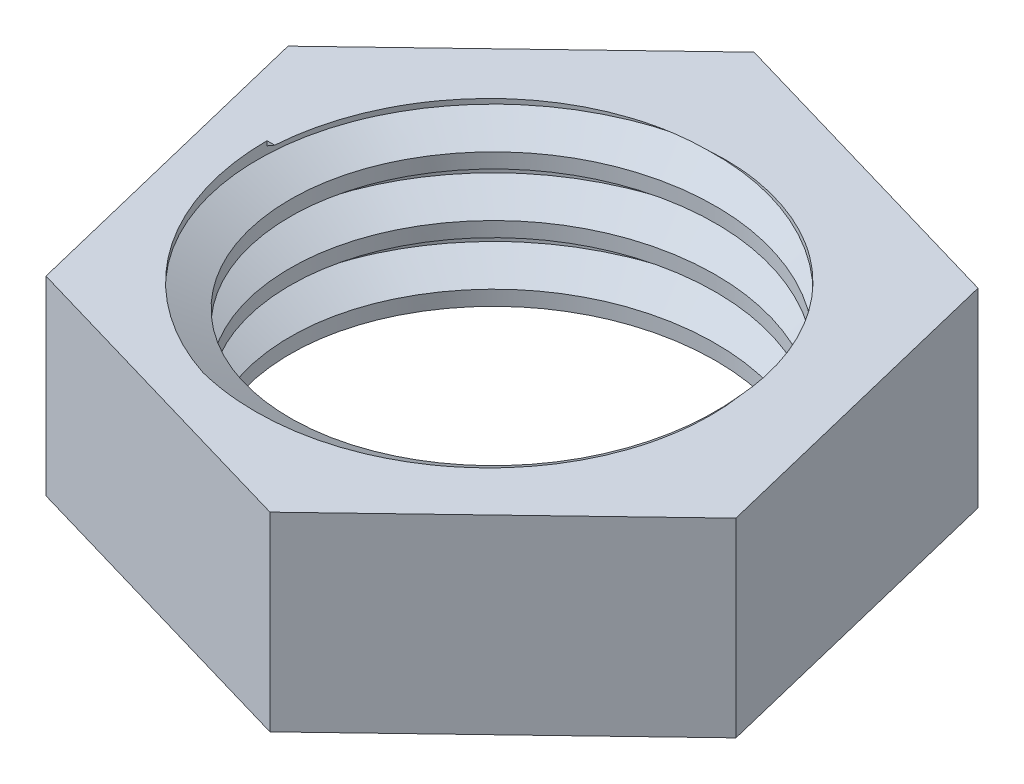
from build123d import *

# Parameters (mm, degrees)
BOSS_EXTRUDE1_DEPTH = 4
SKETCH2_R           = 5.15
CUT_EXTRUDE1_DEPTH  = 11.272655189
THREAD2_PITCH       = 1.25
SKETCH7_R           = 21.028311622
CUT_EXTRUDE2_DEPTH  = 11.701830703
SKETCH8_R           = 21.037382845
CUT_EXTRUDE3_DEPTH  = 11.272655358


with BuildPart() as part:
    # Sketch1 → Boss-Extrude1 (new body)
    with BuildSketch(Plane(origin=(0, 0, 0), x_dir=(1, 0, 0), z_dir=(0, 1, 0))):
        Polygon((5.00756352, 4.787933541), (-1.642690318, 6.73064399), (-6.650253838, 1.942710449), (-5.00756352, -4.787933541), (1.642690318, -6.73064399), (6.650253838, -1.942710449), align=None)
    extrude(amount=BOSS_EXTRUDE1_DEPTH)

    # Sketch2 → Cut-Extrude1 (cut, through all)
    with BuildSketch(Plane(origin=(0, 4, 0), x_dir=(1, 0, 0), z_dir=(0, 1, 0))):
        with Locations(Location((0, 0, 0), (0, 0, 270))):
            Circle(SKETCH2_R)
    extrude(amount=-CUT_EXTRUDE1_DEPTH, mode=Mode.SUBTRACT)

    # Thread2: the profile of Thread Profile2 profile screwed along a right-hand helix of 6.4 turns, 8 arcs to a turn; built about Z, then put on its axis
    thread2_z = Axis((0, 0, 0), (0, 0, 1))
    thread2_corners = [(5.1503, 0, -0.000173205), (5.1503, 0, 1.093923202), (4.473417656, 0, 0.703124998), (4.473417656, 0, 0.390624998)]
    with BuildLine(mode=Mode.PRIVATE) as thread2_profile:
        Line(thread2_corners[0], thread2_corners[1])
        Line(thread2_corners[1], thread2_corners[2])
        Line(thread2_corners[2], thread2_corners[3])
        Line(thread2_corners[3], thread2_corners[0])
    thread2_cap = Face(thread2_profile.wire())
    thread2_turn_angles = [0, 22.5, 45, 67.5, 90, 112.5, 135, 157.5, 180, 202.5, 225, 247.5, 270, 292.5, 315, 337.5, 360]
    thread2_turn_weights = [1, 0.9238795325112867, 1, 0.9238795325112867, 1, 0.9238795325112867, 1, 0.9238795325112867, 1, 0.9238795325112867, 1, 0.9238795325112867, 1, 0.9238795325112867, 1, 0.9238795325112867, 1]
    thread2_turn_rails = [Edge.make_bspline([Vector(p[0], p[1], 0).rotate(thread2_z, thread2_turn_angles[k]) / thread2_turn_weights[k] + Vector(0, 0, p[2] + THREAD2_PITCH * thread2_turn_angles[k] / 360) for k in range(17)], [0, 0, 0, 1, 1, 2, 2, 3, 3, 4, 4, 5, 5, 6, 6, 7, 7, 8, 8, 8], 2, thread2_turn_weights) for p in thread2_corners]
    thread2_turn_sides = [Face.make_surface_from_curves(thread2_turn_rails[p[0]], thread2_turn_rails[p[1]]) for p in [(0, 1), (1, 2), (2, 3), (3, 0)]]
    thread2_last_angles = [2160, 2182.5, 2205, 2227.5, 2250, 2272.5, 2295, 2299.5, 2304]
    thread2_last_weights = [1, 0.9238795325112867, 1, 0.9238795325112867, 1, 0.9238795325112867, 1, 0.996917333733128, 1]
    thread2_last_rails = [Edge.make_bspline([Vector(p[0], p[1], 0).rotate(thread2_z, thread2_last_angles[k]) / thread2_last_weights[k] + Vector(0, 0, p[2] + THREAD2_PITCH * thread2_last_angles[k] / 360) for k in range(9)], [0, 0, 0, 1, 1, 2, 2, 3, 3, 4, 4, 4], 2, thread2_last_weights) for p in thread2_corners]
    thread2_last_sides = [Face.make_surface_from_curves(thread2_last_rails[p[0]], thread2_last_rails[p[1]]) for p in [(0, 1), (1, 2), (2, 3), (3, 0)]]
    thread2 = Plane(origin=(0, 5, 0), x_dir=(-1, 0, 0), z_dir=(0, -1, 0)) * Solid(Shell([*[p.moved(Location((0, 0, THREAD2_PITCH * i))) for i in range(6) for p in thread2_turn_sides], *thread2_last_sides, thread2_cap, thread2_cap.rotate(thread2_z, 2304).moved(Location((0, 0, THREAD2_PITCH * 2304 / 360)))]))
    add(thread2)

    # Sketch7 → Cut-Extrude2 (cut, through all)
    with BuildSketch(Plane.XZ):
        with Locations((-8.727451128, 7.028819701)):
            Circle(SKETCH7_R)
    extrude(amount=CUT_EXTRUDE2_DEPTH, mode=Mode.SUBTRACT)

    # Sketch8 → Cut-Extrude3 (cut, through all)
    with BuildSketch(Plane(origin=(0, 4, 0), x_dir=(1, 0, 0), z_dir=(0, 1, 0))):
        with Locations((-10.113690569, 5.935447747)):
            Circle(SKETCH8_R)
    extrude(amount=CUT_EXTRUDE3_DEPTH, mode=Mode.SUBTRACT)


solid = part.part
